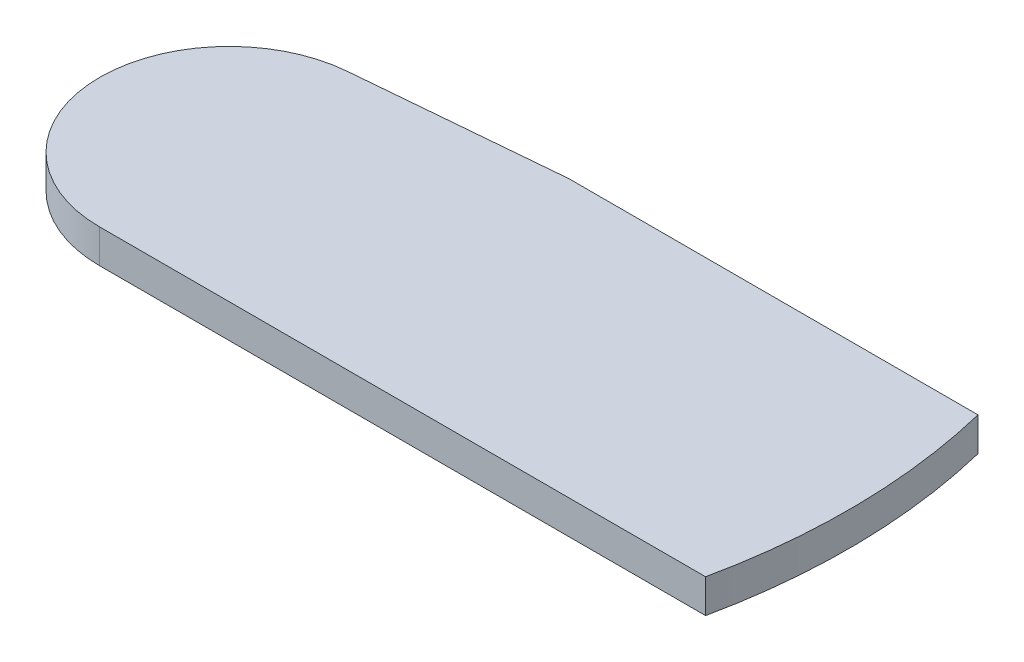
from build123d import *

# Parameters (mm, degrees)
BOSS_EXTRUDE1_DEPTH = 2.6


with BuildPart() as part:
    # Sketch1 → Boss-Extrude1 (new body)
    with BuildSketch(Plane(origin=(0, 0, 0), x_dir=(1, 0, 0), z_dir=(0, 1, 0))):
        with BuildLine():
            Line((-29.565238745, 11.34310087), (-45.335497693, 9.961863662))
            ThreePointArc((-45.335497693, 9.961863662), (-54.453449813, -0.436671148), (-44.462988446, -10))
            Line((-44.462988446, -10), (2.323097165, -10))
            ThreePointArc((2.323097165, -10), (3.374896218, 0.688910471), (2.015736466, 11.34310087))
            Line((2.015736466, 11.34310087), (-29.565238745, 11.34310087))
        make_face()
    extrude(amount=BOSS_EXTRUDE1_DEPTH)


solid = part.part
